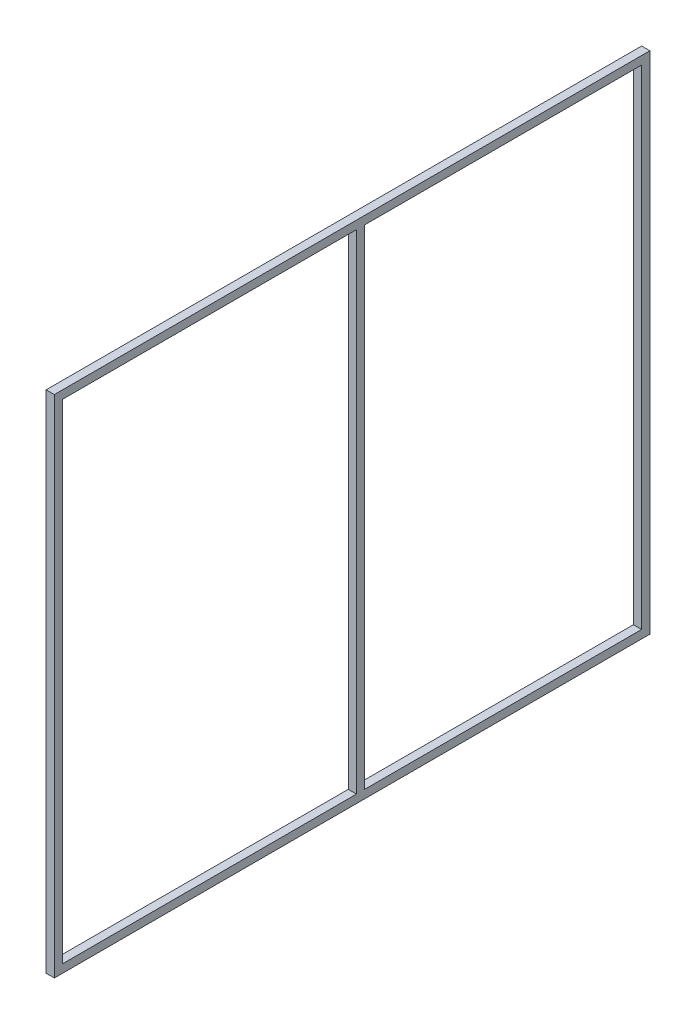
from build123d import *

# Parameters (mm, degrees)
SKETCH1_W           = 1118.25
SKETCH1_H           = 944.035
BOSS_EXTRUDE1_DEPTH = 15.875
BOSS_EXTRUDE3_REACH = 1121.064
SKETCH3_W           = 15.875
SKETCH3_H           = 15.875


with BuildPart() as part:
    # Sketch1 → Boss-Extrude1 (new body)
    with BuildSketch(Plane(origin=(0, 0, 0), x_dir=(0, 0, -1), z_dir=(1, 0, 0))):
        Polygon((-575, -487.8925), (-575, 487.8925), (575, 487.8925), (575, -487.8925), (559.125, -487.8925), (-559.125, -487.8925), align=None)
        Rectangle(SKETCH1_W, SKETCH1_H, mode=Mode.SUBTRACT)
    extrude(amount=BOSS_EXTRUDE1_DEPTH)

    # Sketch3 → Boss-Extrude3 (add, up to next)
    with BuildSketch(Plane(origin=(0, -472.0175, 0), x_dir=(1, 0, 0), z_dir=(0, 1, 0)), mode=Mode.PRIVATE) as boss_extrude3_sk1:
        with Locations((7.9375, 16.375)):
            Rectangle(SKETCH3_W, SKETCH3_H)
    boss_extrude3_tool1 = extrude(boss_extrude3_sk1.sketch, amount=BOSS_EXTRUDE3_REACH, mode=Mode.PRIVATE) - part.part
    add(boss_extrude3_tool1.solids().sort_by_distance((7.9375, -472.0175, -16.375))[0])


solid = part.part
